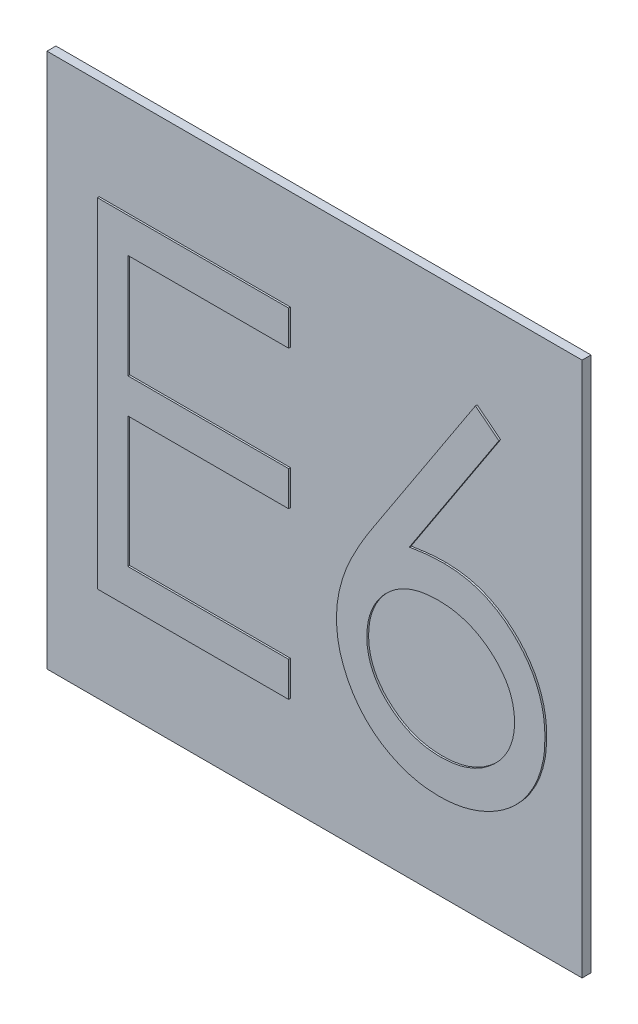
from build123d import *

# Parameters (mm, degrees)
SKETCH1_W           = 76.2
SKETCH1_H           = 76.2
BOSS_EXTRUDE1_DEPTH = 1.27
BOSS_EXTRUDE2_DEPTH = 0.254


with BuildPart() as part:
    # Sketch1 → Boss-Extrude1 (new body)
    with BuildSketch(Plane.XY):
        with Locations((38.1, 38.1)):
            Rectangle(SKETCH1_W, SKETCH1_H)
    extrude(amount=BOSS_EXTRUDE1_DEPTH)

    # Sketch2 → Boss-Extrude2 (add)
    # profile 1 of 2: a face of its own
    with BuildSketch(Plane.XY.offset(1.27)):
        Polygon((7.438286123, 61.974293726), (34.661875867, 61.974293726), (34.661875867, 57.024550136), (11.769311764, 57.024550136), (11.769311764, 42.175319367), (34.661875867, 42.175319367), (34.661875867, 37.225575777), (11.769311764, 37.225575777), (11.769311764, 18.664037315), (34.661875867, 18.664037315), (34.661875867, 13.714293726), (7.438286123, 13.714293726), align=None)
    # profile 2 of 2: a face of its own
    with BuildSketch(Plane.XY.offset(1.27)):
        with BuildLine():
            Line((61.266747661, 63.211729623), (64.602024104, 60.591845809))
            Line((64.602024104, 60.591845809), (51.850633879, 41.092562956))
            add(Edge.make_bspline(
                [(51.850633879, 41.092562956), (52.699600041, 41.227882075), (54.35560453, 41.491837316), (56.031824605, 41.535380872), (56.848714809, 41.556601418)],
                knots=[0, 0, 0, 0, 1.025318673, 2, 2, 2, 2], degree=3))
            add(Edge.make_bspline(
                [(56.848714809, 41.556601418), (57.339208715, 41.543418004), (58.304731374, 41.517466845), (59.722290309, 41.317755235), (61.084448609, 41.003029549), (62.38556044, 40.544252671), (63.630295899, 39.958205922), (64.82579808, 39.255831671), (65.949594368, 38.400861918), (67.016156628, 37.445797128), (67.984487977, 36.387979507), (68.84180696, 35.265571362), (69.561939808, 34.079742071), (70.146215653, 32.831092257), (70.599926922, 31.521546684), (70.930682279, 30.152780852), (71.126198607, 28.723850905), (71.152748374, 27.752057551), (71.166234841, 27.258416322)],
                knots=[0, 0, 0, 0, 1.04369286, 2.054478336, 3.041073146, 4.015093852, 4.984733326, 5.965804835, 6.960378782, 7.985147595, 9.009457201, 10.008161701, 10.986880575, 11.956520048, 12.937015923, 13.931873656, 14.949455224, 16, 16, 16, 16], degree=3))
            add(Edge.make_bspline(
                [(71.166234841, 27.258416322), (71.146612258, 26.583056175), (71.107999657, 25.254107236), (70.723246173, 23.318512993), (70.125378614, 21.47453265), (69.270797037, 19.751606922), (68.20931995, 18.152097205), (66.914882058, 16.734832473), (65.433389845, 15.470833616), (63.75826045, 14.413848347), (61.955501751, 13.550641706), (60.061613924, 12.930635254), (58.094989329, 12.548919759), (56.760192076, 12.501065106), (56.084984841, 12.476857828)],
                knots=[0, 0, 0, 0, 1.031375318, 2.029502543, 3.004789286, 3.987476834, 4.960371455, 5.9300674, 6.912260825, 7.929083631, 8.949397511, 9.960523116, 10.96833055, 12, 12, 12, 12], degree=3))
            add(Edge.make_bspline(
                [(56.084984841, 12.476857828), (55.43558862, 12.497929602), (54.149248406, 12.539669097), (52.257004221, 12.911490858), (50.438801587, 13.514149366), (48.70737921, 14.344418247), (47.10348413, 15.393147799), (45.668567668, 16.655660825), (44.409784514, 18.104970192), (43.362203027, 19.740851094), (42.531321197, 21.49875548), (41.908216687, 23.331768956), (41.544250201, 25.233212704), (41.493390272, 26.522184069), (41.467773302, 27.17140911)],
                knots=[0, 0, 0, 0, 1.012016664, 2.004627821, 2.994792927, 3.992885782, 4.990978636, 5.973936114, 6.964471063, 7.975201453, 8.993600317, 9.990122807, 10.98767138, 12, 12, 12, 12], degree=3))
            add(Edge.make_bspline(
                [(41.467773302, 27.17140911), (41.484063741, 27.668412421), (41.517325705, 28.683198219), (41.749571996, 30.22012793), (42.122756852, 31.792729417), (42.540691849, 33.126831527), (42.98227926, 34.219734684), (43.349779706, 35.100872529), (43.80720172, 36.007623784), (44.294950113, 36.971081405), (44.856929112, 37.9664154), (45.467978609, 39.010260853), (46.144992652, 40.086016622), (46.619597525, 40.816041439), (46.862220418, 41.189237636)],
                knots=[0, 0, 0, 0, 1.173818275, 2.396712641, 3.66331629, 4.989737886, 5.693666774, 6.447286557, 7.243889047, 8.091586357, 8.998013824, 9.943181721, 10.948533338, 12, 12, 12, 12], degree=3))
            Line((46.862220418, 41.189237636), (61.266747661, 63.211729623))
        make_face()
        with BuildLine():
            add(Edge.make_bspline(
                [(55.939972822, 36.606857828), (55.572338554, 36.596129717), (54.854242034, 36.5751746), (53.800692939, 36.453486984), (52.803596506, 36.224333811), (51.849742657, 35.932480331), (50.956964331, 35.531190713), (50.118773071, 35.043739908), (49.331927527, 34.46984332), (48.604669296, 33.817631329), (47.945304453, 33.103548337), (47.377475489, 32.338702868), (46.887672338, 31.541527599), (46.489433316, 30.705361848), (46.1793273, 29.830525256), (45.955011361, 28.921041435), (45.830173065, 27.970811602), (45.809404284, 27.32643715), (45.798798943, 26.997394687)],
                knots=[0, 0, 0, 0, 1.129588631, 2.206414736, 3.251139165, 4.268635594, 5.265702196, 6.250456724, 7.242448911, 8.251968645, 9.246821453, 10.222880186, 11.173611482, 12.116736599, 13.062300278, 14.020270554, 14.989073742, 16, 16, 16, 16], degree=3))
            add(Edge.make_bspline(
                [(45.798798943, 26.997394687), (45.807435574, 26.67129525), (45.824370719, 26.031862801), (45.978145278, 25.089563143), (46.213034728, 24.182759006), (46.562442586, 23.316125246), (46.979228193, 22.476452015), (47.529465606, 21.694153479), (48.139151915, 20.921716741), (48.867932152, 20.21847931), (49.650066294, 19.564120257), (50.485670303, 18.992166819), (51.356555921, 18.502863182), (52.27448073, 18.119387876), (53.226421418, 17.804673567), (54.220309287, 17.583208713), (55.256835574, 17.458001231), (55.958976354, 17.437205396), (56.317004072, 17.426601418)],
                knots=[0, 0, 0, 0, 0.989467248, 1.94019797, 2.891935182, 3.827694429, 4.772920941, 5.730924762, 6.725747692, 7.756678648, 8.79901574, 9.819492441, 10.826891316, 11.826466727, 12.835195252, 13.867842842, 14.912794438, 16, 16, 16, 16], degree=3))
            add(Edge.make_bspline(
                [(56.317004072, 17.426601418), (56.675031203, 17.437206228), (57.377170832, 17.458003693), (58.413705458, 17.583199356), (59.407562503, 17.804707901), (60.359615219, 18.119263413), (61.277126494, 18.503324899), (62.147250454, 18.989122741), (62.974952109, 19.567637667), (63.757599691, 20.217361058), (64.483346509, 20.925719296), (65.107655503, 21.687258269), (65.641042027, 22.482774666), (66.074474561, 23.31281757), (66.420033966, 24.18328302), (66.65611454, 25.089422761), (66.809571535, 26.031899554), (66.826550316, 26.671307663), (66.8352092, 26.997394687)],
                knots=[0, 0, 0, 0, 1.087397944, 2.132534446, 3.165364764, 4.174271784, 5.174024072, 6.181601208, 7.194203697, 8.236725232, 9.267838612, 10.269026844, 11.221737037, 12.171628256, 13.107553087, 14.05945871, 15.010357665, 16, 16, 16, 16], degree=3))
            add(Edge.make_bspline(
                [(66.8352092, 26.997394687), (66.827621446, 27.326866409), (66.812729152, 27.97351225), (66.644288672, 28.92061638), (66.41067754, 29.835146224), (66.057924094, 30.711354081), (65.599639622, 31.545782266), (65.041431273, 32.342645883), (64.395677032, 33.108054272), (63.649749243, 33.819031738), (62.837737046, 34.46912259), (61.974357575, 35.042996816), (61.0710962, 35.527320066), (60.128868754, 35.931423139), (59.136879177, 36.223044174), (58.111142672, 36.452668606), (57.038540143, 36.57486317), (56.31082611, 36.596057103), (55.939972822, 36.606857828)],
                knots=[0, 0, 0, 0, 0.978206639, 1.919901502, 2.851605144, 3.780102724, 4.718870031, 5.675451981, 6.667674623, 7.690630536, 8.733308323, 9.756129687, 10.767539656, 11.776269907, 12.797430371, 13.836405707, 14.897401972, 16, 16, 16, 16], degree=3))
        make_face(mode=Mode.SUBTRACT)
    extrude(amount=BOSS_EXTRUDE2_DEPTH)


solid = part.part
